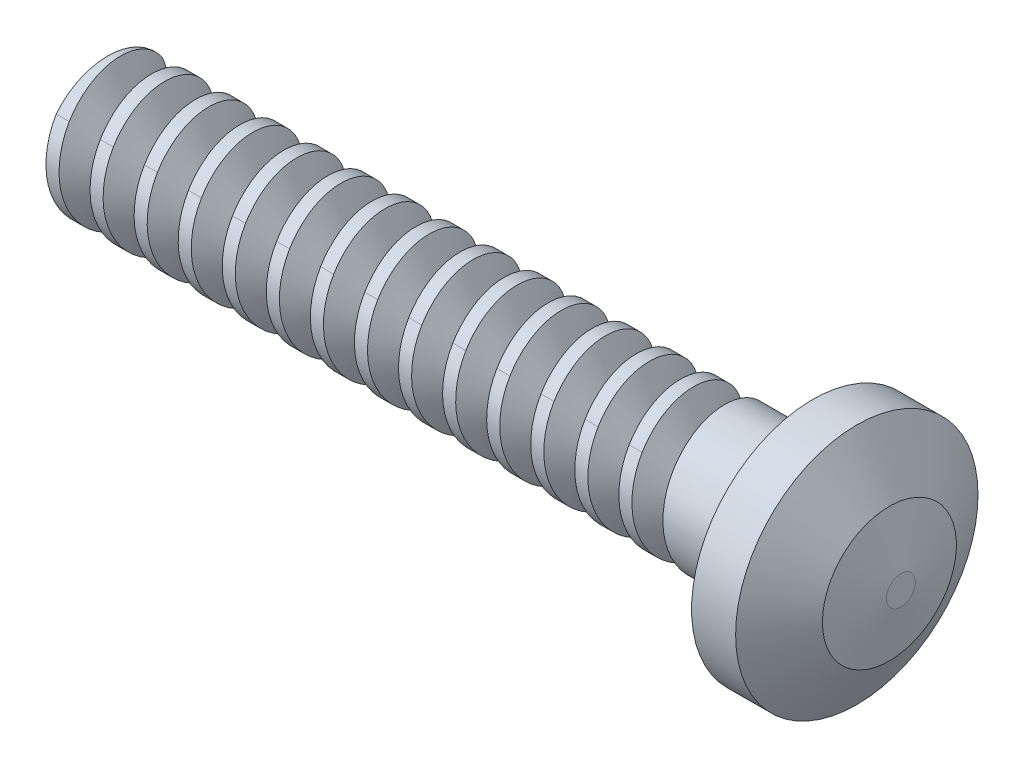
from build123d import *

# Parameters (mm, degrees)
SKETCH_1_R      = 1.5
EXTRUDE_1_DEPTH = 16
SKETCH_2_R      = 2.75
EXTRUDE_2_DEPTH = 2
SWEEP_1_PITCH   = 1


with BuildPart() as part:
    # 草图1 → 凸台-拉伸1 (new body)
    with BuildSketch(Plane(origin=(0, 0, 0), x_dir=(0, 0, -1), z_dir=(1, 0, 0))):
        Circle(SKETCH_1_R)
    extrude(amount=EXTRUDE_1_DEPTH)

    # 草图2 → 凸台-拉伸2 (add)
    with BuildSketch(Plane(origin=(16, 0, 0), x_dir=(0, 0, -1), z_dir=(1, 0, 0))):
        Circle(SKETCH_2_R)
    extrude(amount=EXTRUDE_2_DEPTH)

    # 草图3 → 切除-旋转7 (revolve, cut)
    with BuildSketch(Plane(origin=(0, 0, 0), x_dir=(1, 0, 0), z_dir=(0, 1, 0))):
        Polygon((17, -2.75), (18, -2.75), (18, -0.327781001), (17.739768101, -1.519910816), align=None)
    revolve(axis=Axis((16, 0, 0), (-1, 0, 0)), mode=Mode.SUBTRACT)

    # 切除-扫描1: arcs per turn and ends read off the stored shape
    # 切除-扫描1: the profile of 草图4 screwed along a right-hand helix through 15 turns, 8 arcs to a turn; built about Z, then put on its axis
    sweep_1_z = Axis((0, 0, 0), (0, 0, 1))
    sweep_1_corners = [(1.5, 2.62e-07, -0.749999972), (1.5, 2.62e-07, -1.094770554), (0.924191397, 1.61e-07, -0.749999972), (1.5, 2.62e-07, -0.391403988)]
    with BuildLine(mode=Mode.PRIVATE) as sweep_1_profile:
        Line(sweep_1_corners[0], sweep_1_corners[1])
        Line(sweep_1_corners[1], sweep_1_corners[2])
        Line(sweep_1_corners[2], sweep_1_corners[3])
        Line(sweep_1_corners[3], sweep_1_corners[0])
    sweep_1_cap = Face(sweep_1_profile.wire())
    sweep_1_turn_angles = [0, 22.5, 45, 67.5, 90, 112.5, 135, 157.5, 180, 202.5, 225, 247.5, 270, 292.5, 315, 337.5, 360]
    sweep_1_turn_weights = [1, 0.9238795325112867, 1, 0.9238795325112867, 1, 0.9238795325112867, 1, 0.9238795325112867, 1, 0.9238795325112867, 1, 0.9238795325112867, 1, 0.9238795325112867, 1, 0.9238795325112867, 1]
    sweep_1_turn_rails = [Edge.make_bspline([Vector(p[0], p[1], 0).rotate(sweep_1_z, sweep_1_turn_angles[k]) / sweep_1_turn_weights[k] + Vector(0, 0, p[2] + SWEEP_1_PITCH * sweep_1_turn_angles[k] / 360) for k in range(17)], [0, 0, 0, 1, 1, 2, 2, 3, 3, 4, 4, 5, 5, 6, 6, 7, 7, 8, 8, 8], 2, sweep_1_turn_weights) for p in sweep_1_corners]
    sweep_1_turn_sides = [Face.make_surface_from_curves(sweep_1_turn_rails[p[0]], sweep_1_turn_rails[p[1]]) for p in [(0, 1), (1, 2), (2, 3), (3, 0)]]
    sweep_1 = Plane(origin=(0, 0, 0), x_dir=(0, 0, -1), z_dir=(1, 0, 0)) * Solid(Shell([*[p.moved(Location((0, 0, SWEEP_1_PITCH * i))) for i in range(15) for p in sweep_1_turn_sides], sweep_1_cap, sweep_1_cap.rotate(sweep_1_z, 5400).moved(Location((0, 0, SWEEP_1_PITCH * 5400 / 360)))]))
    add(sweep_1, mode=Mode.SUBTRACT)


solid = part.part
